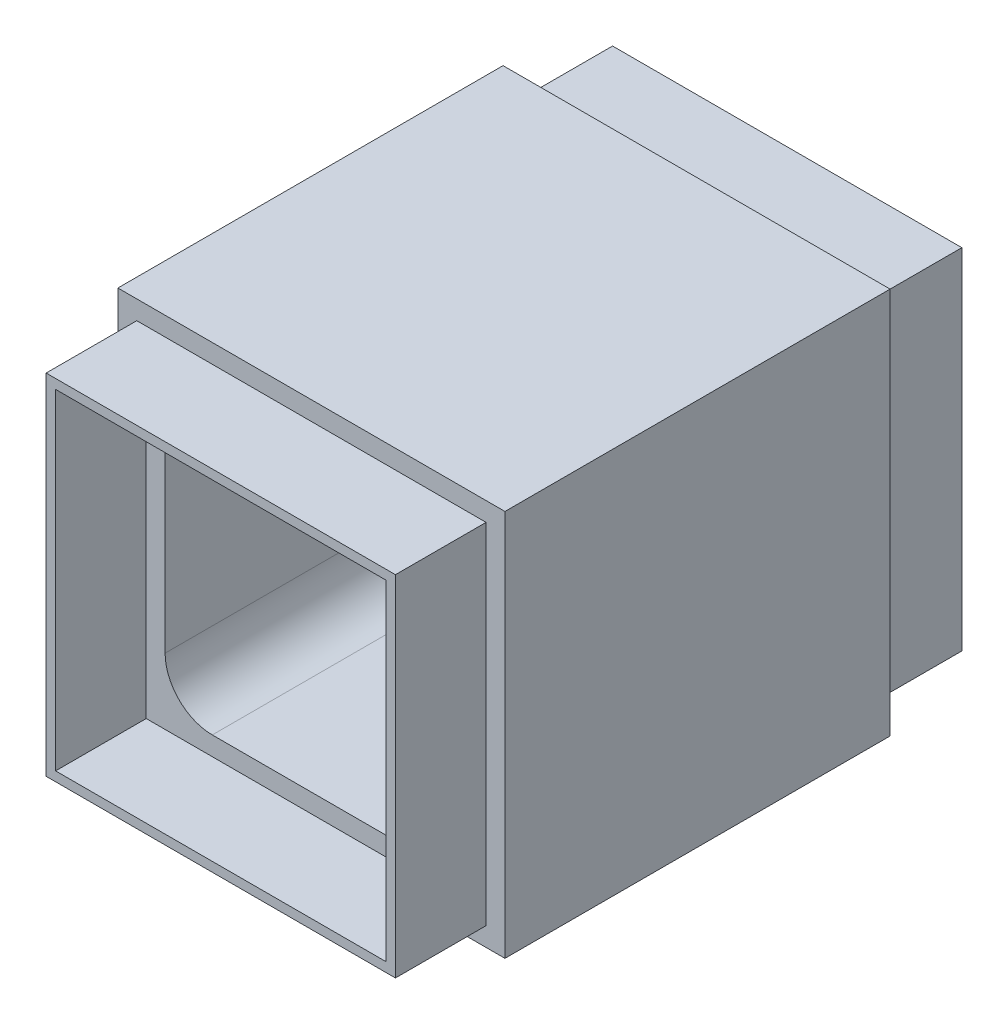
from build123d import *

# Parameters (mm, degrees)
SKETCH1_W           = 52.07
SKETCH1_H           = 52.07
BOSS_EXTRUDE1_DEPTH = 76.2
SKETCH2_W           = 39.37
SKETCH2_H           = 39.37
CUT_EXTRUDE1_DEPTH  = 106.967022229
SKETCH3_W           = 52.07
SKETCH3_H           = 52.07
SKETCH3_W_2         = 46.99
SKETCH3_H_2         = 46.99
SKETCH3_W_3         = 44.45
SKETCH3_H_3         = 44.45
SKETCH3_W_4         = 39.37
SKETCH3_H_4         = 39.37
CUT_EXTRUDE2_DEPTH  = 12.192
FILLET1_R           = 6.35


with BuildPart() as part:
    # Sketch1 → Boss-Extrude1 (new body)
    with BuildSketch(Plane.XY):
        with Locations((26.035, 26.035)):
            Rectangle(SKETCH1_W, SKETCH1_H)
    extrude(amount=-BOSS_EXTRUDE1_DEPTH)

    # Sketch2 → Cut-Extrude1 (cut, through all)
    with BuildSketch(Plane.XY):
        with Locations((26.035, 26.035)):
            Rectangle(SKETCH2_W, SKETCH2_H)
    extrude(amount=-CUT_EXTRUDE1_DEPTH, mode=Mode.SUBTRACT)

    # Sketch3 → Cut-Extrude2 (cut)
    # profile 1 of 2: a face of its own
    with BuildSketch(Plane.XY):
        with Locations((26.035, 26.035)):
            Rectangle(SKETCH3_W, SKETCH3_H)
        with Locations((26.035, 26.035)):
            Rectangle(SKETCH3_W_2, SKETCH3_H_2, mode=Mode.SUBTRACT)
    # profile 2 of 2: a face of its own
    with BuildSketch(Plane.XY):
        with Locations((26.035, 26.035)):
            Rectangle(SKETCH3_W_3, SKETCH3_H_3)
        with Locations((26.035, 26.035)):
            Rectangle(SKETCH3_W_4, SKETCH3_H_4, mode=Mode.SUBTRACT)
    cut_extrude2 = extrude(amount=-CUT_EXTRUDE2_DEPTH, mode=Mode.SUBTRACT)

    # Mirror1: Cut-Extrude2 across plane
    add(cut_extrude2.mirror(Plane(origin=(0, 0, -38.1), x_dir=(1, 0, 0), z_dir=(0, 0, -1))), mode=Mode.SUBTRACT)

    # Fillet1
    fillet1_edges = [part.edges().sort_by_distance(p)[0] for p in [
        (6.35, 45.72, -38.1),
        (45.72, 45.72, -38.1),
        (45.72, 6.35, -38.1),
        (6.35, 6.35, -38.1),
    ]]
    fillet(fillet1_edges, radius=FILLET1_R)


solid = part.part
